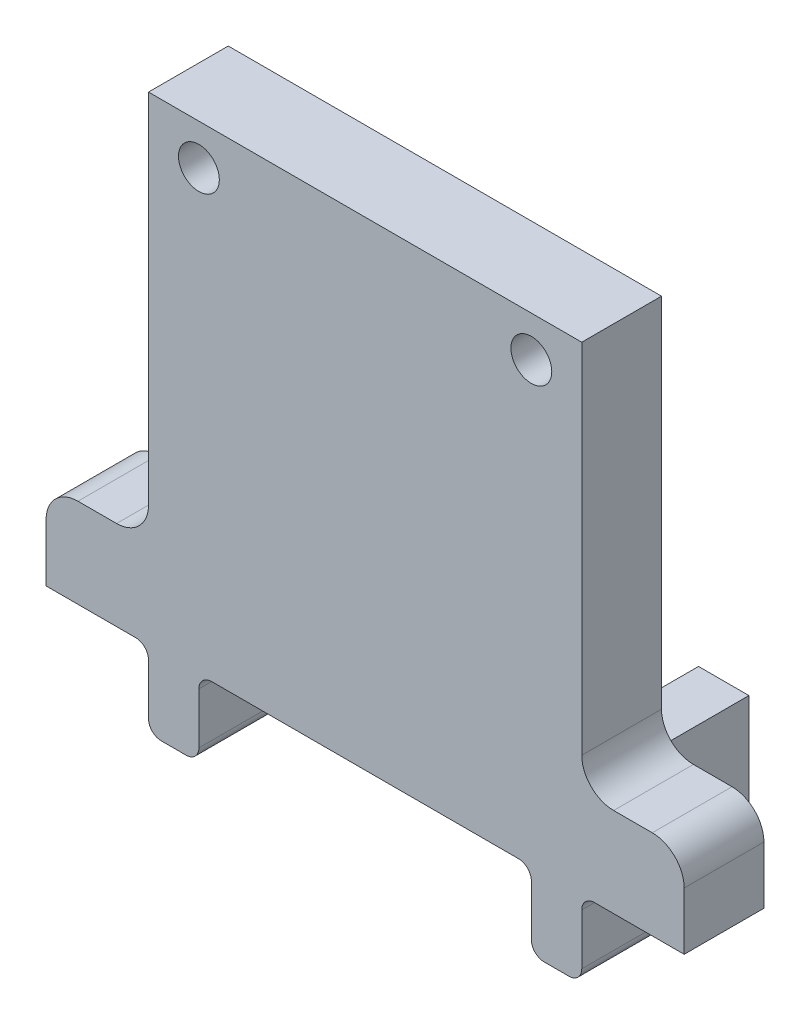
from build123d import *

# Parameters (mm, degrees)
SKETCH1_W                  = 3.95
SKETCH1_H                  = 13.1
BOSS_EXTRUDE1_DEPTH        = 13
SKETCH2_W                  = 3.95
SKETCH2_H                  = 13.1
BOSS_EXTRUDE2_DEPTH        = 13
BOSS_EXTRUDE3_REACH        = 37.222
SKETCH3_W                  = 6.25
SKETCH3_H                  = 7
SKETCH10_W                 = 8.025
SKETCH10_H                 = 7
BOSS_EXTRUDE7_DEPTH        = 6.25
FILLET7_R                  = 1
SKETCH11_W                 = 33.95
SKETCH11_H                 = 6.25
BOSS_EXTRUDE8_DEPTH        = 30.5283
F_3_2_3_2_DIAMETER_HOLE1_D = 3.2
FILLET8_START              = -7
FILLET8_DEPTH              = 8
FILLET8_START_2            = -6.25
FILLET8_2_DEPTH            = 6.25
FILLET9_R                  = 1


with BuildPart() as part:
    # Sketch1 → Boss-Extrude1 (new body)
    with BuildSketch(Plane(origin=(0, 0, 0), x_dir=(1, 0, 0), z_dir=(0, 1, 0))):
        with Locations((0, 6.55)):
            Rectangle(SKETCH1_W, SKETCH1_H)
    extrude(amount=BOSS_EXTRUDE1_DEPTH)


with BuildPart() as body_2:
    # Sketch2 → Boss-Extrude2 (new body)
    with BuildSketch(Plane(origin=(0, 0, 0), x_dir=(1, 0, 0), z_dir=(0, 1, 0))):
        with Locations((30, 6.55)):
            Rectangle(SKETCH2_W, SKETCH2_H)
    extrude(amount=BOSS_EXTRUDE2_DEPTH)

    # Sketch3 → Boss-Extrude3 (add, up to next)
    with BuildSketch(Plane(origin=(1.975, 0, 0), x_dir=(0, 0, -1), z_dir=(1, 0, 0)), mode=Mode.PRIVATE) as boss_extrude3_sk1:
        with Locations((3.125, 9.5)):
            Rectangle(SKETCH3_W, SKETCH3_H)
    boss_extrude3_tool1 = extrude(boss_extrude3_sk1.sketch, amount=BOSS_EXTRUDE3_REACH, mode=Mode.PRIVATE) - body_2.part

    add(part.part)  # Boss-Extrude3 merges part
    add(boss_extrude3_tool1.solids().sort_by_distance((1.975, 9.5, -3.125))[0])

    # Sketch10 → Boss-Extrude7 (add)
    with BuildSketch(Plane.XY):
        with Locations((-5.9875, 9.5)):
            Rectangle(SKETCH10_W, SKETCH10_H)
        with Locations((35.9875, 9.5)):
            Rectangle(SKETCH10_W, SKETCH10_H)
    extrude(amount=-BOSS_EXTRUDE7_DEPTH)

    # Fillet7
    fillet7_edges = [body_2.edges().sort_by_distance(p)[0] for p in [
        (28.025, 0, -6.55),
        (31.975, 0, -6.55),
        (1.975, 0, -6.55),
        (-1.975, 0, -6.55),
    ]]
    fillet(fillet7_edges, radius=FILLET7_R)

    # Sketch11 → Boss-Extrude8 (add)
    with BuildSketch(Plane(origin=(0, 13, 0), x_dir=(1, 0, 0), z_dir=(0, 1, 0))):
        with Locations((15, 3.125)):
            Rectangle(SKETCH11_W, SKETCH11_H)
    extrude(amount=BOSS_EXTRUDE8_DEPTH)

    # Ø3.2 (3.2) Diameter Hole1 (through all)
    with Locations(Plane.XY):
        with Locations((28.025, 40.3533), (1.975, 40.3533)):
            Hole(F_3_2_3_2_DIAMETER_HOLE1_D / 2)

    # Fillet8: read off the stored shape, not the designer's step
    # Fillet8 outline → Fillet8 (cut)
    with BuildSketch(Plane.XY.offset(FILLET8_START)):
        with BuildLine():
            Line((40, 13), (37.5, 13))
            ThreePointArc((37.5, 13), (39.267766953, 12.267766953), (40, 10.5))
            Line((40, 10.5), (40, 13))
        make_face()
        with BuildLine():
            Line((-10, 13), (-10, 10.5))
            ThreePointArc((-10, 10.5), (-9.267766953, 12.267766953), (-7.5, 13))
            Line((-7.5, 13), (-10, 13))
        make_face()
    extrude(amount=FILLET8_DEPTH, mode=Mode.SUBTRACT)

    # Fillet8 2 outline → Fillet8 2 (add)
    with BuildSketch(Plane.XY.offset(FILLET8_START_2)):
        with BuildLine():
            Line((31.975, 13), (34.475, 13))
            ThreePointArc((34.475, 13), (32.707233047, 13.732233047), (31.975, 15.5))
            Line((31.975, 15.5), (31.975, 13))
        make_face()
        with BuildLine():
            ThreePointArc((-1.975, 15.5), (-2.707233047, 13.732233047), (-4.475, 13))
            Line((-4.475, 13), (-1.975, 13))
            Line((-1.975, 13), (-1.975, 15.5))
        make_face()
    extrude(amount=FILLET8_2_DEPTH)

    # Fillet9
    fillet9_edges = [body_2.edges().sort_by_distance(p)[0] for p in [
        (28.025, 6, -3.125),
        (1.975, 6, -3.125),
        (-1.975, 6, -3.125),
        (31.975, 6, -3.125),
    ]]
    fillet(fillet9_edges, radius=FILLET9_R)


solid = body_2.part
